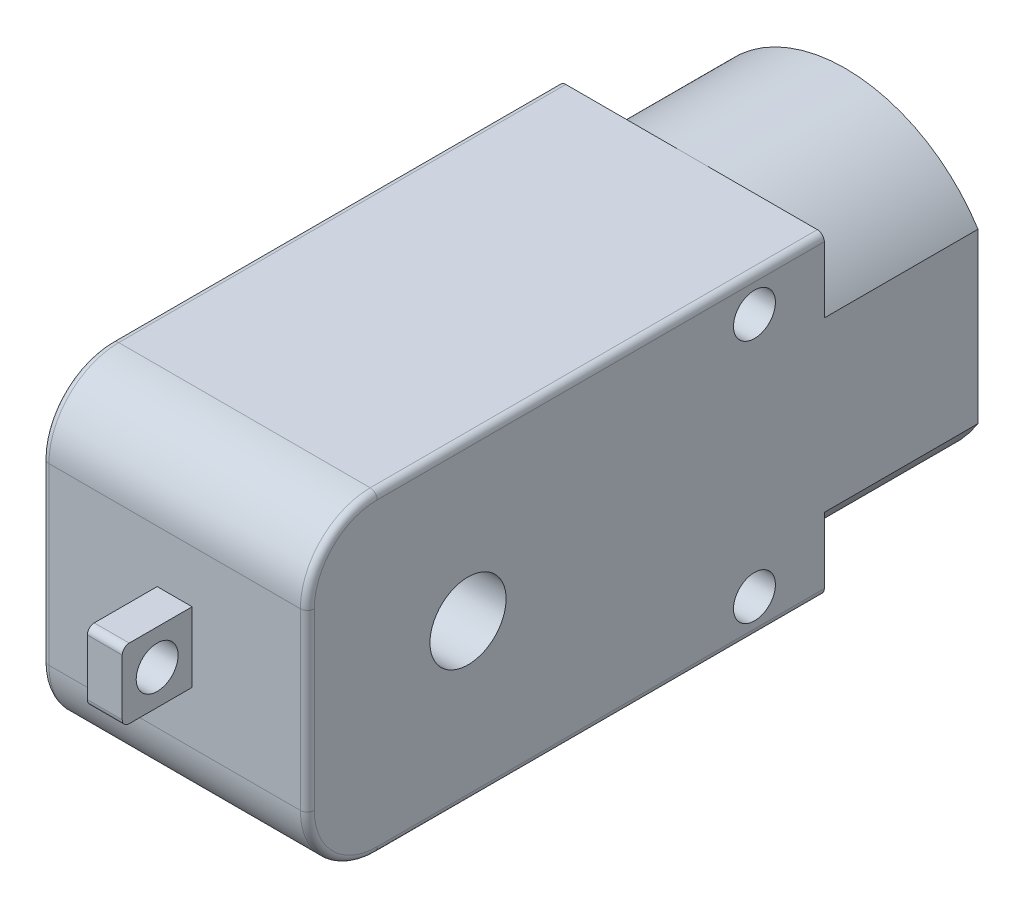
from build123d import *

# Parameters (mm, degrees)
SKETCH1_W           = 19
SKETCH1_H           = 22.5
BOSS_EXTRUDE1_DEPTH = 37
BOSS_EXTRUDE2_DEPTH = 11
FILLET1_R           = 5
SKETCH3_R           = 1.5
CUT_EXTRUDE1_DEPTH  = 44.087846314
SKETCH4_W           = 2.5
SKETCH4_H           = 5
BOSS_EXTRUDE3_DEPTH = 5
FILLET2_R           = 0.5
SKETCH5_R           = 1.5
CUT_EXTRUDE2_DEPTH  = 5
SKETCH6_R           = 2.725
CUT_EXTRUDE3_DEPTH  = 48.45063224
CUT_EXTRUDE4_DEPTH  = 11
SKETCH8_R           = 3
CUT_EXTRUDE5_DEPTH  = 2


with BuildPart() as part:
    # Sketch1 → Boss-Extrude1 (new body)
    with BuildSketch(Plane.XY):
        Rectangle(SKETCH1_W, SKETCH1_H)
    extrude(amount=BOSS_EXTRUDE1_DEPTH)

    # Sketch2 → Boss-Extrude2 (add)
    with BuildSketch(Plane(origin=(0, 0, 0), x_dir=(-1, 0, 0), z_dir=(0, 0, -1))):
        with BuildLine():
            Line((9.5, 6.025985397), (9.5, -6.025985397))
            ThreePointArc((9.5, -6.025985397), (0, -11.25), (-9.5, -6.025985397))
            Line((-9.5, -6.025985397), (-9.5, 6.025985397))
            ThreePointArc((-9.5, 6.025985397), (0, 11.25), (9.5, 6.025985397))
        make_face()
    extrude(amount=BOSS_EXTRUDE2_DEPTH)

    # Fillet1
    fillet1_edges = [part.edges().sort_by_distance(p)[0] for p in [
        (0, -11.25, 37),
        (0, 11.25, 37),
    ]]
    fillet(fillet1_edges, radius=FILLET1_R)

    # Sketch3 → Cut-Extrude1 (cut, through all)
    with BuildSketch(Plane(origin=(9.5, 0, 0), x_dir=(0, 0, -1), z_dir=(1, 0, 0))):
        with Locations((-5, 8.75)):
            Circle(SKETCH3_R)
        with Locations((-5, -8.75)):
            Circle(SKETCH3_R)
    extrude(amount=-CUT_EXTRUDE1_DEPTH, mode=Mode.SUBTRACT)

    # Sketch4 → Boss-Extrude3 (add)
    with BuildSketch(Plane.XY.offset(37)):
        Rectangle(SKETCH4_W, SKETCH4_H)
    extrude(amount=BOSS_EXTRUDE3_DEPTH)

    # Fillet2
    fillet2_edges = [part.edges().sort_by_distance(p)[0] for p in [
        (0, -2.5, 42),
        (0, 2.5, 42),
        (-9.5, -11.25, 16),
        (-9.5, -9.785533906, 35.535533906),
        (-9.5, 0, 37),
        (-9.5, 9.785533906, 35.535533906),
        (9.5, -11.25, 16),
        (9.5, -9.785533906, 35.535533906),
        (9.5, 0, 37),
        (9.5, 9.785533906, 35.535533906),
        (-9.5, 11.25, 16),
        (9.5, 11.25, 16),
    ]]
    fillet(fillet2_edges, radius=FILLET2_R)

    # Sketch5 → Cut-Extrude2 (cut)
    with BuildSketch(Plane(origin=(1.25, 0, 0), x_dir=(0, 0, -1), z_dir=(1, 0, 0))):
        with Locations((-39.5, 0)):
            Circle(SKETCH5_R)
    extrude(amount=-CUT_EXTRUDE2_DEPTH, mode=Mode.SUBTRACT)

    # Sketch6 → Cut-Extrude3 (cut, through all)
    with BuildSketch(Plane(origin=(9.5, 0, 0), x_dir=(0, 0, -1), z_dir=(1, 0, 0))):
        with Locations((-25.5, 0)):
            Circle(SKETCH6_R)
    extrude(amount=-CUT_EXTRUDE3_DEPTH, mode=Mode.SUBTRACT)

    # Sketch7 → Cut-Extrude4 (cut)
    with BuildSketch(Plane(origin=(0, 0, -11), x_dir=(-1, 0, 0), z_dir=(0, 0, -1))):
        with BuildLine():
            Line((-8.3, 5.666789214), (-8.3, -5.666789214))
            ThreePointArc((-8.3, -5.666789214), (0, -10.05), (8.3, -5.666789214))
            Line((8.3, -5.666789214), (8.3, 5.666789214))
            ThreePointArc((8.3, 5.666789214), (0, 10.05), (-8.3, 5.666789214))
        make_face()
    extrude(amount=-CUT_EXTRUDE4_DEPTH, mode=Mode.SUBTRACT)

    # Sketch8 → Cut-Extrude5 (cut)
    with BuildSketch(Plane(origin=(0, 0, 0), x_dir=(-1, 0, 0), z_dir=(0, 0, -1))):
        Circle(SKETCH8_R)
    extrude(amount=-CUT_EXTRUDE5_DEPTH, mode=Mode.SUBTRACT)


solid = part.part
